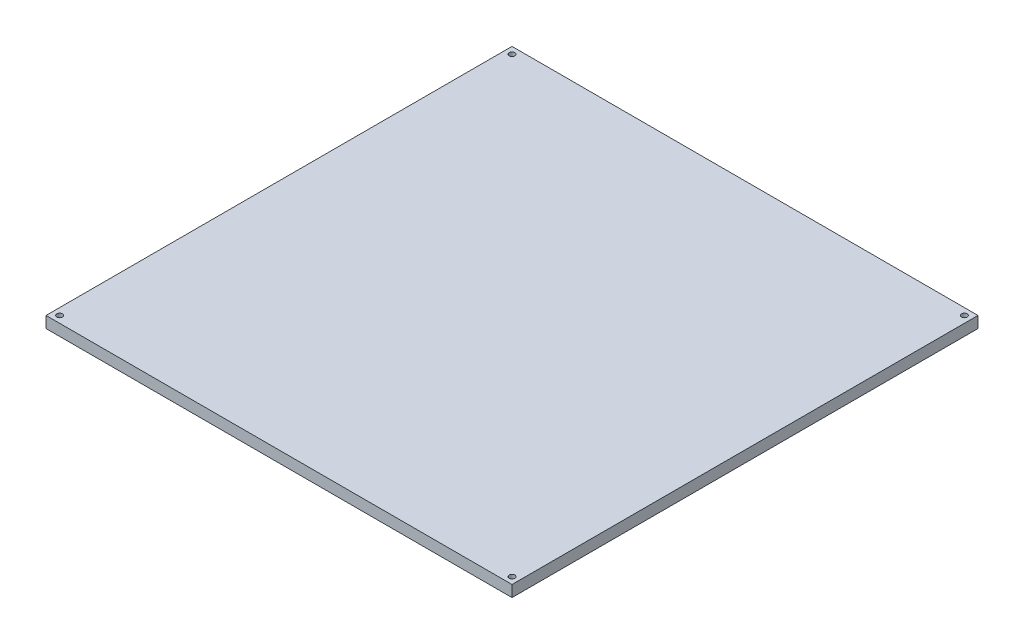
from build123d import *

# Parameters (mm, degrees)
SKETCH1_W                           = 205
SKETCH1_H                           = 205
BOSS_EXTRUDE1_DEPTH                 = 5
TAP_DRILL_FOR_M3X0_5_TAP1_OUTLINE_R = 1.25
TAP_DRILL_FOR_M3X0_5_TAP1_DEPTH     = 5


# Read off the part's stored shape, not the designer's step: Tap Drill for M3x0.5 Tap1
with BuildPart() as part:
    # Sketch1 → Boss-Extrude1 (new body)
    with BuildSketch(Plane(origin=(0, 0, 0), x_dir=(1, 0, 0), z_dir=(0, 1, 0))):
        Rectangle(SKETCH1_W, SKETCH1_H)
    extrude(amount=BOSS_EXTRUDE1_DEPTH)

    # Tap Drill for M3x0.5 Tap1 outline → Tap Drill for M3x0.5 Tap1 (cut)
    with BuildSketch(Plane(origin=(0, 0, 0), x_dir=(1, 0, 0), z_dir=(0, 1, 0))):
        with Locations((99.5, 99.5)):
            Circle(TAP_DRILL_FOR_M3X0_5_TAP1_OUTLINE_R)
        with Locations((-99.5, -99.5)):
            Circle(TAP_DRILL_FOR_M3X0_5_TAP1_OUTLINE_R)
        with Locations((99.5, -99.5)):
            Circle(TAP_DRILL_FOR_M3X0_5_TAP1_OUTLINE_R)
        with Locations((-99.5, 99.5)):
            Circle(TAP_DRILL_FOR_M3X0_5_TAP1_OUTLINE_R)
    extrude(amount=TAP_DRILL_FOR_M3X0_5_TAP1_DEPTH, mode=Mode.SUBTRACT)


solid = part.part
